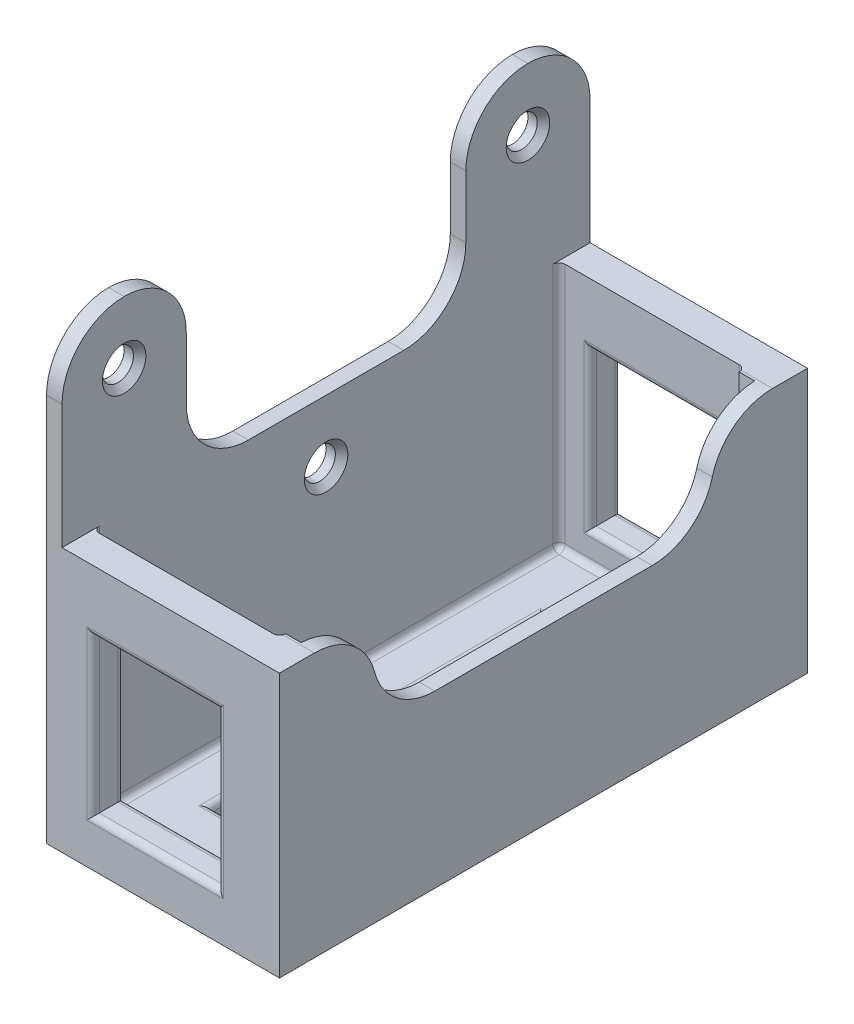
from build123d import *

# Parameters (mm, degrees)
SKETCH1_W           = 40
SKETCH1_H           = 85
BOSS_EXTRUDE1_DEPTH = 75
SKETCH3_OUTSIDE_W   = 66.042
SKETCH3_OUTSIDE_H   = 111.042
SKETCH3_OUTSIDE_W_2 = 40
SKETCH3_OUTSIDE_H_2 = 85
SKETCH3_OUTSIDE_W_3 = 30
SKETCH3_OUTSIDE_H_3 = 75
CUT_EXTRUDE2_DEPTH  = 70
SKETCH4_W           = 35
SKETCH4_H           = 85
CUT_EXTRUDE3_DEPTH  = 30
FILLET1_R           = 10
SKETCH5_R           = 2.5
CUT_EXTRUDE4_DEPTH  = 30
CHAMFER1_SIZE       = 1
CUT_EXTRUDE5_DEPTH  = 30
FILLET2_R           = 1
FILLET3_R           = 10
SKETCH7_W           = 14
SKETCH7_H           = 53
CUT_EXTRUDE6_DEPTH  = 30
FILLET4_R           = 1
CUT_EXTRUDE7_DEPTH  = 30
FILLET5_R           = 10
SKETCH9_R           = 2.5
CUT_EXTRUDE8_DEPTH  = 30
CHAMFER2_SIZE       = 1
SKETCH10_W          = 20
SKETCH10_H          = 25
CUT_EXTRUDE9_DEPTH  = 130
FILLET6_R           = 1
FILLET7_R           = 1
SKETCH12_W          = 99.145482585
SKETCH12_H          = 91.596568109
CUT_EXTRUDE11_DEPTH = 2.5
SKETCH13_W          = 51.22831634
SKETCH13_H          = 105.793314496
CUT_EXTRUDE12_DEPTH = 2.5
SKETCH14_W          = 73
SKETCH14_H          = 70.039653543
CUT_EXTRUDE13_DEPTH = 2.5


# Some blends are built 0.0001 mm under size
with BuildPart() as part:
    # Sketch1 → Boss-Extrude1 (new body)
    with BuildSketch(Plane(origin=(0, 0, 0), x_dir=(1, 0, 0), z_dir=(0, 1, 0))):
        with Locations((-11.153846154, 11.538461538)):
            Rectangle(SKETCH1_W, SKETCH1_H)
    extrude(amount=BOSS_EXTRUDE1_DEPTH)

    # Sketch3 outside → Cut-Extrude2 (cut)
    # profile 1 of 2: a face of its own
    with BuildSketch(Plane(origin=(0, 75, 0), x_dir=(1, 0, 0), z_dir=(0, 1, 0))):
        with Locations((-11.154, 11.538)):
            Rectangle(SKETCH3_OUTSIDE_W, SKETCH3_OUTSIDE_H)
        with Locations((-11.153846154, 11.538461538)):
            Rectangle(SKETCH3_OUTSIDE_W_2, SKETCH3_OUTSIDE_H_2, mode=Mode.SUBTRACT)
    # profile 2 of 2: a face of its own
    with BuildSketch(Plane(origin=(0, 75, 0), x_dir=(1, 0, 0), z_dir=(0, 1, 0))):
        with Locations((-11.153846154, 11.538461538)):
            Rectangle(SKETCH3_OUTSIDE_W_3, SKETCH3_OUTSIDE_H_3)
    extrude(amount=-CUT_EXTRUDE2_DEPTH, mode=Mode.SUBTRACT)

    # Sketch4 → Cut-Extrude3 (cut)
    with BuildSketch(Plane(origin=(0, 75, 0), x_dir=(1, 0, 0), z_dir=(0, 1, 0))):
        with Locations((-8.653846154, 11.538461538)):
            Rectangle(SKETCH4_W, SKETCH4_H)
    extrude(amount=-CUT_EXTRUDE3_DEPTH, mode=Mode.SUBTRACT)

    # Fillet1
    fillet1_edges = [part.edges().sort_by_distance(p)[0] for p in [
        (-28.653846154, 75, -54.038461538),
        (-28.653846154, 75, 30.961538462),
    ]]
    fillet(fillet1_edges, radius=FILLET1_R)

    # Sketch5 → Cut-Extrude4 (cut)
    with BuildSketch(Plane(origin=(-26.153846154, 0, 0), x_dir=(0, 0, -1), z_dir=(1, 0, 0))):
        with Locations((-20.961538462, 65)):
            Circle(SKETCH5_R)
        with Locations((44.038461538, 65)):
            Circle(SKETCH5_R)
    extrude(amount=-CUT_EXTRUDE4_DEPTH, mode=Mode.SUBTRACT)

    # Chamfer1
    chamfer1_edges = [part.edges().sort_by_distance(p)[0] for p in [
        (-26.153846154, 65, 23.461538462),
        (-26.153846154, 65, -41.538461538),
    ]]
    chamfer(chamfer1_edges, length=CHAMFER1_SIZE)

    # Sketch6 → Cut-Extrude5 (cut)
    with BuildSketch(Plane(origin=(8.846153846, 0, 0), x_dir=(0, 0, -1), z_dir=(1, 0, 0))):
        with BuildLine():
            Line((-15.961538462, 45), (39.038461538, 45))
            Line((39.038461538, 45), (39.038461538, 40))
            ThreePointArc((39.038461538, 40), (36.10952935, 32.928932188), (29.038461538, 30))
            Line((29.038461538, 30), (-5.961538462, 30))
            ThreePointArc((-5.961538462, 30), (-13.032606273, 32.928932188), (-15.961538462, 40))
            Line((-15.961538462, 40), (-15.961538462, 45))
        make_face()
    extrude(amount=-CUT_EXTRUDE5_DEPTH, mode=Mode.SUBTRACT)

    # Fillet2
    fillet2_edges = [part.edges().sort_by_distance(p)[0] for p in [
        (-11.153846154, 5, 25.961538462),
        (3.846153846, 25, 25.961538462),
        (-26.153846154, 5, -11.538461538),
        (-26.153846154, 25, 25.961538462),
        (-11.153846154, 5, -49.038461538),
        (-26.153846154, 25, -49.038461538),
        (3.846153846, 5, -11.538461538),
        (3.846153846, 25, -49.038461538),
    ]]
    fillet(fillet2_edges, radius=FILLET2_R)

    # Fillet3
    # the kernel refuses this fillet: 10 mm, written as the material it takes off along each edge
    with BuildSketch(Plane(origin=(32.258445674, 45, 15.961538462), x_dir=(0, -0.9991049126334702, -0.04230098759681175), z_dir=(-1, 0, 0))) as fillet3_piece_1:
        with BuildLine():
            CenterArc((9.5949039, 9.779544188), FILLET3_R, 182.424391449, 75.522487814)
            Line((-0.396145226, 9.356534312), (-1.395250139, 9.314233325))
            Line((-1.395250139, 9.314233325), (-0.999104913, -0.042300988))
            Line((-0.999104913, -0.042300988), (0.042300988, -0.999104913))
            ThreePointArc((0.042300988, -0.999104913), (5.037825551, -0.787599975), (7.297900696, -0.977954419))
            Line((7.297900696, -0.977954419), (7.506719169, 0))
        make_face()
    extrude(amount=51.824583655, mode=Mode.SUBTRACT)
    with BuildSketch(Plane(origin=(32.258445674, 45, -39.038461538), x_dir=(0, -0.9991049126334705, 0.04230098759681053), z_dir=(-1, 0, 0))) as fillet3_piece_2:
        with BuildLine():
            CenterArc((9.5949039, -9.779544188), FILLET3_R, 102.053120737, 75.522487814)
            Line((-0.396145226, -9.356534312), (-1.395250139, -9.314233325))
            Line((-1.395250139, -9.314233325), (-0.999104913, 0.042300988))
            Line((-0.999104913, 0.042300988), (0.042300988, 0.999104913))
            ThreePointArc((0.042300988, 0.999104913), (5.037825551, 0.787599975), (7.297900696, 0.977954419))
            Line((7.297900696, 0.977954419), (7.506719169, 0))
        make_face()
    extrude(amount=51.824583655, mode=Mode.SUBTRACT)

    # Sketch7 → Cut-Extrude6 (cut)
    with BuildSketch(Plane(origin=(0, 5, 0), x_dir=(1, 0, 0), z_dir=(0, 1, 0))):
        with Locations((-11.153846154, 11.538461538)):
            Rectangle(SKETCH7_W, SKETCH7_H)
    extrude(amount=-CUT_EXTRUDE6_DEPTH, mode=Mode.SUBTRACT)

    # Fillet4
    fillet4_edges = [part.edges().sort_by_distance(p)[0] for p in [
        (-18.153846154, 5, -11.538461538),
        (-11.153846154, 5, 14.961538462),
        (-4.153846154, 5, -11.538461538),
        (-11.153846154, 5, -38.038461538),
    ]]
    fillet(fillet4_edges, radius=FILLET4_R)

    # Sketch8 → Cut-Extrude7 (cut)
    with BuildSketch(Plane(origin=(-26.153846154, 0, 0), x_dir=(0, 0, -1), z_dir=(1, 0, 0))):
        with BuildLine():
            Line((-10.961538462, 75), (34.038461538, 75))
            Line((34.038461538, 75), (34.038461538, 55))
            ThreePointArc((34.038461538, 55), (31.10952935, 47.928932188), (24.038461538, 45))
            Line((24.038461538, 45), (-0.961538462, 45))
            ThreePointArc((-0.961538462, 45), (-8.032606273, 47.928932188), (-10.961538462, 55))
            Line((-10.961538462, 55), (-10.961538462, 75))
        make_face()
    extrude(amount=-CUT_EXTRUDE7_DEPTH, mode=Mode.SUBTRACT)

    # Fillet5
    fillet5_edges = [part.edges().sort_by_distance(p)[0] for p in [
        (-28.653846154, 75, -34.038461538),
        (-28.653846154, 75, 10.961538462),
    ]]
    fillet(fillet5_edges, radius=FILLET5_R - 0.0001)  # a hair under: the kernel refuses the full size

    # Sketch9 → Cut-Extrude8 (cut)
    with BuildSketch(Plane(origin=(-26.153846154, 0, 0), x_dir=(0, 0, -1), z_dir=(1, 0, 0))):
        with Locations((11.538461538, 35)):
            Circle(SKETCH9_R)
    extrude(amount=-CUT_EXTRUDE8_DEPTH, mode=Mode.SUBTRACT)

    # Chamfer2
    chamfer2_edges = [part.edges().sort_by_distance(p)[0] for p in [
        (-26.153846154, 35, -9.038461538),
    ]]
    chamfer(chamfer2_edges, length=CHAMFER2_SIZE)

    # Sketch10 → Cut-Extrude9 (cut)
    with BuildSketch(Plane.XY.offset(30.961538462)):
        with Locations((-11.153846154, 22.5)):
            Rectangle(SKETCH10_W, SKETCH10_H)
    extrude(amount=-CUT_EXTRUDE9_DEPTH, mode=Mode.SUBTRACT)

    # Fillet6
    fillet6_edges = [part.edges().sort_by_distance(p)[0] for p in [
        (-21.153846154, 22.5, 25.961538462),
        (-11.153846154, 35, 25.961538462),
        (-1.153846154, 22.5, 25.961538462),
        (-11.153846154, 10, 25.961538462),
        (-21.153846154, 22.5, 30.961538462),
        (-11.153846154, 10, 30.961538462),
        (-1.153846154, 22.5, 30.961538462),
        (-11.153846154, 35, 30.961538462),
    ]]
    fillet(fillet6_edges, radius=FILLET6_R)

    # Fillet7
    fillet7_edges = [part.edges().sort_by_distance(p)[0] for p in [
        (-11.153846154, 10, -49.038461538),
        (-1.153846154, 22.5, -49.038461538),
        (-11.153846154, 35, -49.038461538),
        (-21.153846154, 22.5, -49.038461538),
        (-21.153846154, 22.5, -54.038461538),
        (-11.153846154, 35, -54.038461538),
        (-1.153846154, 22.5, -54.038461538),
        (-11.153846154, 10, -54.038461538),
    ]]
    fillet(fillet7_edges, radius=FILLET7_R)

    # Sketch12 → Cut-Extrude11 (cut)
    with BuildSketch(Plane.ZY.offset(31.153846154)):
        with Locations((-8.86612538, 45.798284055)):
            Rectangle(SKETCH12_W, SKETCH12_H)
    extrude(amount=-CUT_EXTRUDE11_DEPTH, mode=Mode.SUBTRACT)

    # Sketch13 → Cut-Extrude12 (cut)
    with BuildSketch(Plane.XZ):
        with Locations((-8.23266401, -21.935118786)):
            Rectangle(SKETCH13_W, SKETCH13_H)
    extrude(amount=-CUT_EXTRUDE12_DEPTH, mode=Mode.SUBTRACT)

    # Sketch14 → Cut-Extrude13 (cut)
    with BuildSketch(Plane.ZY.offset(-3.846153846)):
        with Locations((-11.538461538, 41.019826772)):
            Rectangle(SKETCH14_W, SKETCH14_H)
    extrude(amount=-CUT_EXTRUDE13_DEPTH, mode=Mode.SUBTRACT)


solid = part.part
